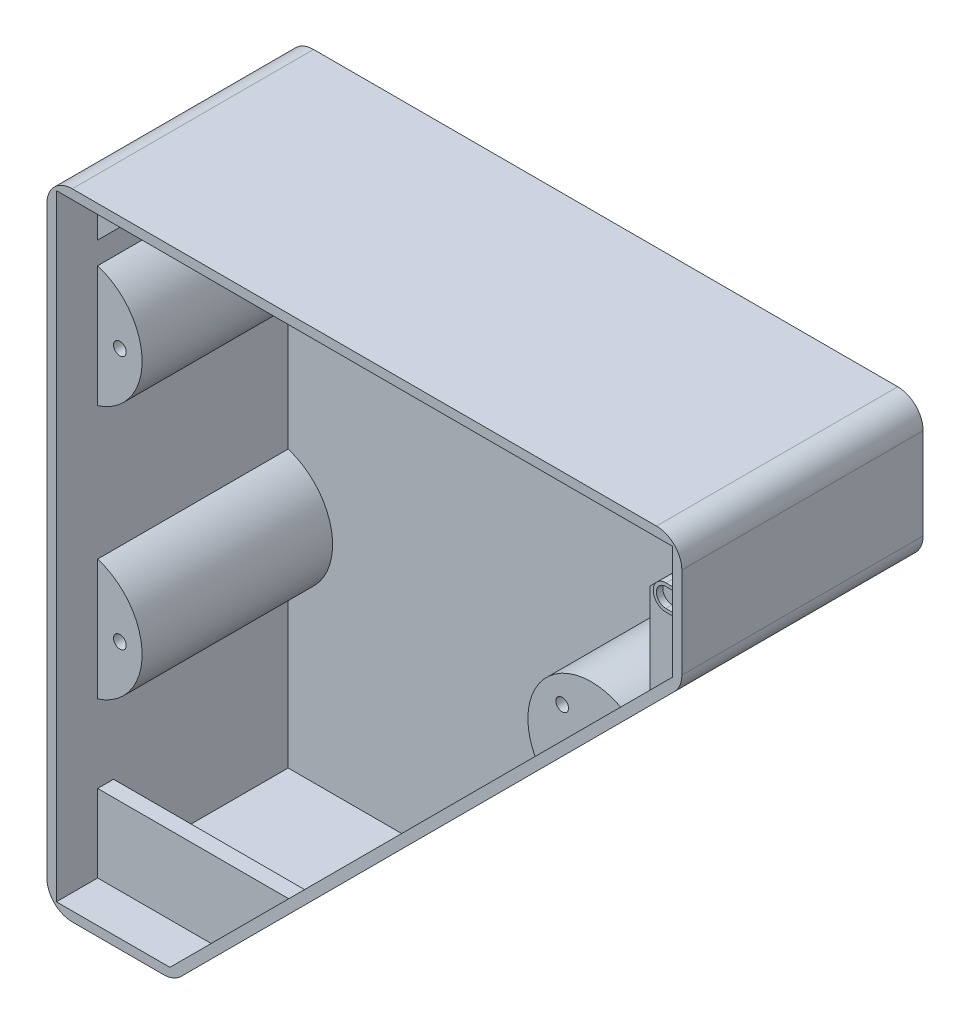
from build123d import *

# Parameters (mm, degrees)
ESTRUSIONE_ESTRUSIONE1_DEPTH  = 80
SVUOTA1_T                     = -3
TAGLIO_ESTRUSIONE1_DEPTH      = 294.938769134
TAGLIO_ESTRUSIONE1_DEPTH_BACK = 294.938769134
SCHIZZO5_W                    = 4
SCHIZZO5_H                    = 200
ESTRUSIONE_ESTRUSIONE4_DEPTH  = 60
SCHIZZO8_R                    = 2
TAGLIO_ESTRUSIONE2_DEPTH      = 30
ESTRUSIONE_ESTRUSIONE7_DEPTH  = 5
ESTRUSIONE_ESTRUSIONE8_DEPTH  = 9
ESTRUSIONE_ESTRUSIONE9_START  = 2
ESTRUSIONE_ESTRUSIONE9_DEPTH  = 2
TAGLIO_ESTRUSIONE3_START      = -3
TAGLIO_ESTRUSIONE3_OUTLINE_W  = 30
TAGLIO_ESTRUSIONE3_OUTLINE_H  = 13
TAGLIO_ESTRUSIONE3_DEPTH      = 3
TAGLIO_ESTRUSIONE5_DEPTH      = 10
SCHIZZO18_R                   = 6
ESTRUSIONE_ESTRUSIONE11_DEPTH = 3
TAGLIO_ESTRUSIONE6_DEPTH      = 292.376045687
TAGLIO_ESTRUSIONE6_DEPTH_BACK = 292.376045687
SCHIZZO19_R                   = 2.5
RACCORDO1_R                   = 8


# Read off the part's stored shape, not the designer's step: Taglio-Estrusione3
with BuildPart() as part:
    # Schizzo2 → Estrusione-Estrusione1 (new body)
    with BuildSketch(Plane.XY):
        Polygon((0, 0), (0, 200), (200, 200), (200, 160), (40, 0), align=None)
    extrude(amount=ESTRUSIONE_ESTRUSIONE1_DEPTH)

    # Svuota1
    svuota1_openings = [part.faces().sort_by_distance(p)[0] for p in [
        (78.039215686, 121.960784314, 80),
    ]]
    offset(amount=SVUOTA1_T, openings=svuota1_openings, kind=Kind.INTERSECTION)

    # Schizzo5 → Taglio-Estrusione1 (cut, two sides: drawn at the far end of the back side and taken through both)
    with BuildSketch(Plane(origin=(200, 0, 0), x_dir=(0, 0, -1), z_dir=(1, 0, 0)).offset(-TAGLIO_ESTRUSIONE1_DEPTH_BACK)):
        with Locations((-78, 100)):
            Rectangle(SCHIZZO5_W, SCHIZZO5_H)
    extrude(amount=TAGLIO_ESTRUSIONE1_DEPTH + TAGLIO_ESTRUSIONE1_DEPTH_BACK, mode=Mode.SUBTRACT)

    # Schizzo7 → Estrusione-Estrusione4 (add)
    with BuildSketch(Plane.XY.offset(63)):
        with BuildLine():
            Line((140.775884186, 105.018524874), (167.757359313, 132))
            ThreePointArc((167.757359313, 132), (144.367126813, 128.408757373), (140.775884186, 105.018524874))
        make_face()
        with BuildLine():
            ThreePointArc((3, 170), (17, 150.921215972), (3, 131.842431943))
            Line((3, 131.842431943), (3, 170))
        make_face()
        with BuildLine():
            ThreePointArc((3, 90), (17, 70.921215972), (3, 51.842431943))
            Line((3, 51.842431943), (3, 90))
        make_face()
    extrude(amount=-ESTRUSIONE_ESTRUSIONE4_DEPTH)

    # Schizzo8 → Taglio-Estrusione2 (cut)
    with BuildSketch(Plane.XY.offset(63)):
        with Locations((10, 150.921215972)):
            Circle(SCHIZZO8_R)
        with Locations((10, 70.921215972)):
            Circle(SCHIZZO8_R)
        with Locations((149.316874281, 123.459009905)):
            Circle(SCHIZZO8_R)
    extrude(amount=-TAGLIO_ESTRUSIONE2_DEPTH, mode=Mode.SUBTRACT)

    # Schizzo11 → Estrusione-Estrusione7 (add)
    with BuildSketch(Plane.XY.offset(63)):
        Polygon((3, 197), (3, 177), (23, 197), align=None)
        Polygon((197, 161.242640687), (197, 197), (177, 197), (177, 141.242640687), align=None)
        Polygon((3, 3), (3, 27.421215972), (63.178575285, 27.421215972), (38.757359313, 3), align=None)
    extrude(amount=-ESTRUSIONE_ESTRUSIONE7_DEPTH)

    # Schizzo12 → Estrusione-Estrusione8 (add)
    with BuildSketch(Plane.XY.offset(72)):
        with BuildLine():
            Line((193, 184), (197, 184))
            Line((197, 184), (197, 176))
            Line((197, 176), (193, 176))
            ThreePointArc((193, 176), (189, 180), (193, 184))
        make_face()
    extrude(amount=-ESTRUSIONE_ESTRUSIONE8_DEPTH)

    # Schizzo13 → Estrusione-Estrusione9 (add)
    with BuildSketch(Plane.XY.offset(72).offset(ESTRUSIONE_ESTRUSIONE9_START)):
        with BuildLine():
            Line((193, 177), (196, 177))
            Line((196, 177), (197, 177))
            Line((197, 177), (197, 176))
            Line((197, 176), (193, 176))
            ThreePointArc((193, 176), (189, 180), (193, 184))
            Line((193, 184), (197, 184))
            Line((197, 184), (197, 183))
            Line((197, 183), (193, 183))
            ThreePointArc((193, 183), (190, 180), (193, 177))
        make_face()
    extrude(amount=-ESTRUSIONE_ESTRUSIONE9_DEPTH)

    # Taglio-Estrusione3 outline → Taglio-Estrusione3 (cut)
    with BuildSketch(Plane(origin=(3, 0, 0), x_dir=(0, 0, -1), z_dir=(1, 0, 0)).offset(TAGLIO_ESTRUSIONE3_START)):
        with Locations((-18, 190.5)):
            Rectangle(TAGLIO_ESTRUSIONE3_OUTLINE_W, TAGLIO_ESTRUSIONE3_OUTLINE_H)
    extrude(amount=TAGLIO_ESTRUSIONE3_DEPTH, mode=Mode.SUBTRACT)

    # Schizzo16 → Taglio-Estrusione5 (cut)
    with BuildSketch(Plane.XY.offset(63)):
        with BuildLine():
            Line((190.171572875, 182.828427125), (177, 169.656854249))
            Line((177, 169.656854249), (177, 197))
            Line((177, 197), (197, 197))
            Line((197, 197), (197, 184))
            Line((197, 184), (193, 184))
            ThreePointArc((193, 184), (191.469266271, 183.69551813), (190.171572875, 182.828427125))
        make_face()
    extrude(amount=-TAGLIO_ESTRUSIONE5_DEPTH, mode=Mode.SUBTRACT)

    # Schizzo18 → Estrusione-Estrusione11 (add)
    with BuildSketch(Plane.XY.offset(3)):
        with Locations(Location((65, 188, 0), (0, 0, 180))):
            Circle(SCHIZZO18_R)
        with Locations(Location((185, 188, 0), (0, 0, 180))):
            Circle(SCHIZZO18_R)
    extrude(amount=ESTRUSIONE_ESTRUSIONE11_DEPTH)

    # Schizzo19 → Taglio-Estrusione6 (cut, two sides: drawn at the far end of the back side and taken through both)
    with BuildSketch(Plane.XY.offset(6).offset(-TAGLIO_ESTRUSIONE6_DEPTH_BACK)):
        with Locations((65, 188)):
            Circle(SCHIZZO19_R)
        with Locations((185, 188)):
            Circle(SCHIZZO19_R)
    extrude(amount=TAGLIO_ESTRUSIONE6_DEPTH + TAGLIO_ESTRUSIONE6_DEPTH_BACK, mode=Mode.SUBTRACT)

    # Raccordo1
    # the kernel refuses this fillet: 8 mm, written as the material it takes off along each edge
    with BuildSketch(Plane(origin=(40, 0, -8.284271247), x_dir=(-1, 0, 0), z_dir=(0, 0, 1)), Plane(origin=(200, 160, -8.284271247), x_dir=(-0.7071067811865432, -0.7071067811865518, 0), z_dir=(0, 0, 1))) as raccordo1_piece_1:
        with BuildLine():
            CenterArc((RACCORDO1_R * 0.414213562373, -RACCORDO1_R), RACCORDO1_R, 90, 45)
            Line((-RACCORDO1_R * 0.292893218813, -RACCORDO1_R * 0.292893218813), (0, 0))
            Line((0, 0), (RACCORDO1_R * 0.414213562373, 0))
        make_face()
    extrude(amount=92.568542495, mode=Mode.SUBTRACT)
    with BuildSketch(Plane(origin=(0, 0, -20), x_dir=(0, 1, 0), z_dir=(0, 0, 1))) as raccordo1_piece_2:
        with BuildLine():
            CenterArc((RACCORDO1_R, -RACCORDO1_R), RACCORDO1_R, 90, 90)
            Line((0, -RACCORDO1_R), (0, 0))
            Line((0, 0), (RACCORDO1_R, 0))
        make_face()
    extrude(amount=116, mode=Mode.SUBTRACT)
    with BuildSketch(Plane(origin=(0, 200, -20), x_dir=(0, -1, 0), z_dir=(0, 0, 1)), Plane(origin=(200, 200, -20), x_dir=(-1, 0, 0), z_dir=(0, 0, 1))) as raccordo1_piece_3:
        with BuildLine():
            CenterArc((RACCORDO1_R, RACCORDO1_R), RACCORDO1_R, 180, 90)
            Line((0, RACCORDO1_R), (0, 0))
            Line((0, 0), (RACCORDO1_R, 0))
        make_face()
    extrude(amount=116, mode=Mode.SUBTRACT)


solid = part.part
